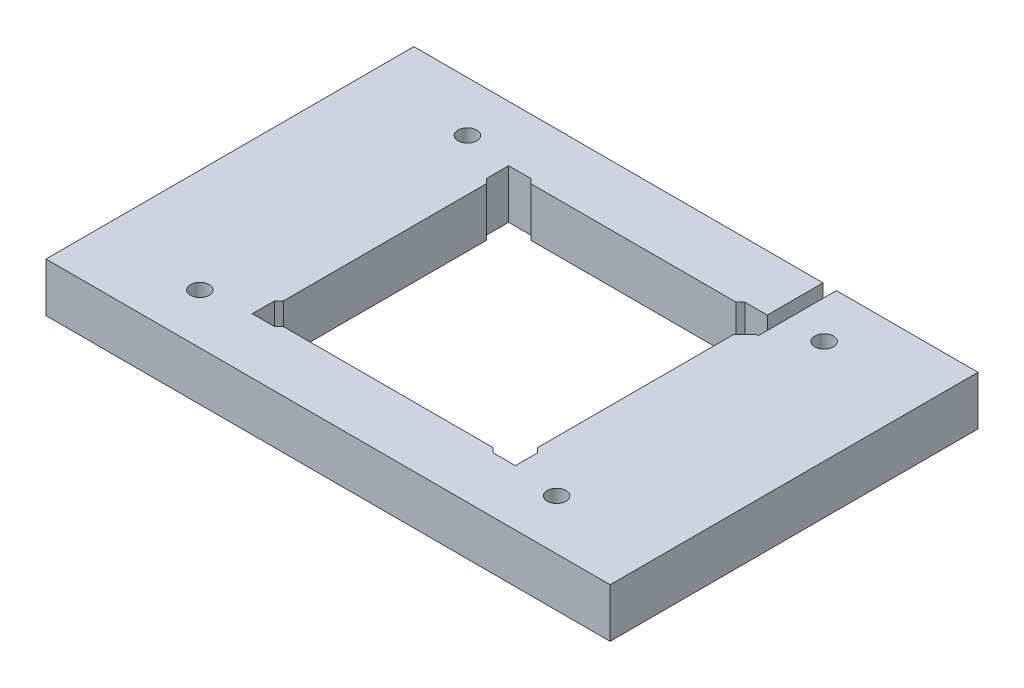
from build123d import *

# Parameters (mm, degrees)
SKETCH_1_R      = 2.1
EXTRUDE_2_DEPTH = 11
CHAMFER_1_SIZE  = 2.5
CHAMFER_2_SIZE  = 1


with BuildPart() as part:
    # Эскиз1 → Бобышка-Вытянуть2 (new body)
    with BuildSketch(Plane(origin=(0, 0, 0), x_dir=(1, 0, 0), z_dir=(0, 1, 0))):
        Polygon((31.5, 27.75), (31.5, 41.25), (63.25, 41.25), (63.25, -41.25), (-63.25, -41.25), (-63.25, 41.25), (28.5, 41.25), (28.5, 28.75), (23.5, 28.75), (23.5, 27.75), (-24.5, 27.75), (-24.5, 28.75), (-29.5, 28.75), (-29.5, 23.75), (-28.5, 23.75), (-28.5, -23.75), (-29.5, -23.75), (-29.5, -28.75), (-24.5, -28.75), (-24.5, -27.75), (24.5, -27.75), (24.5, -28.75), (29.5, -28.75), (29.5, -23.75), (28.5, -23.75), (28.5, 23.75), (31.5, 23.75), align=None)
        with Locations(Location((-40, 30, 0), (0, 0, 270))):
            Circle(SKETCH_1_R, mode=Mode.SUBTRACT)
        with Locations(Location((40, 30, 0), (0, 0, 270))):
            Circle(SKETCH_1_R, mode=Mode.SUBTRACT)
        with Locations(Location((40, -30, 0), (0, 0, 270))):
            Circle(SKETCH_1_R, mode=Mode.SUBTRACT)
        with Locations(Location((-40, -30, 0), (0, 0, 270))):
            Circle(SKETCH_1_R, mode=Mode.SUBTRACT)
    extrude(amount=EXTRUDE_2_DEPTH)

    # Фаска1
    chamfer_1_edges = [part.edges().sort_by_distance(p)[0] for p in [
        (28.5, 5.5, -23.75),
    ]]
    chamfer(chamfer_1_edges, length=CHAMFER_1_SIZE)

    # Фаска2
    chamfer_2_edges = [part.edges().sort_by_distance(p)[0] for p in [
        (23.5, 5.5, -27.75),
        (28.5, 5.5, 23.75),
        (24.5, 5.5, 27.75),
        (-24.5, 5.5, 27.75),
        (-28.5, 5.5, 23.75),
        (-28.5, 5.5, -23.75),
        (-24.5, 5.5, -27.75),
    ]]
    chamfer(chamfer_2_edges, length=CHAMFER_2_SIZE - 0.0001)  # a hair under: the kernel refuses the full size


solid = part.part
